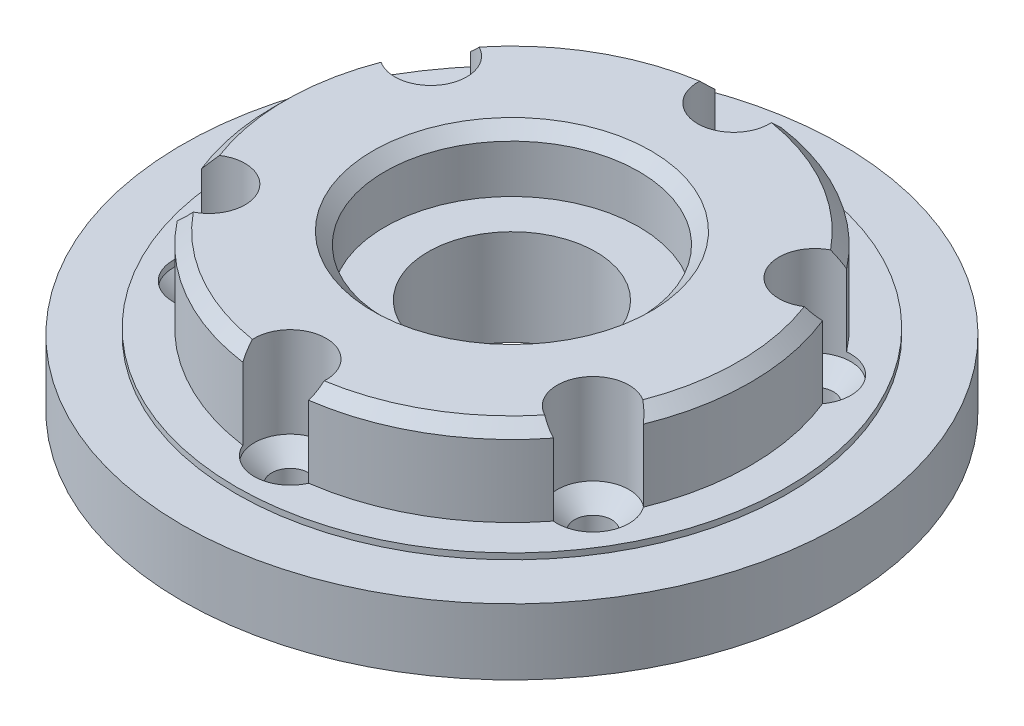
from build123d import *

# Parameters (mm, degrees)
FASE1_SIZE                                 = 1
F_3_1_3_1_DURCHMESSER_BOHRUNG1_D           = 3.1
F_3_1_3_1_DURCHMESSER_BOHRUNG1_DEPTH       = 15
F_3_1_3_1_DURCHMESSER_BOHRUNG1_CSINK_D     = 3.15
F_3_1_3_1_DURCHMESSER_BOHRUNG1_CSINK_ANGLE = 90
F_3_1_3_1_DURCHMESSER_BOHRUNG1_TIP         = 0.931333959
SCHNITT_LINEAR_AUSTRAGEN1_REACH            = 43.006
SKIZZE5_R                                  = 3
FASE2_SIZE                                 = 1.5


with BuildPart() as part:
    # Skizze1 → Rotation1 (revolve)
    with BuildSketch(Plane.XY, mode=Mode.PRIVATE) as rotation1_sk:
        Polygon((7, 0), (27.5, 0), (27.5, 5.5), (23, 5.5), (23, 6), (19.9, 6), (19.9, 13), (10.6, 13), (10.6, 8), (7, 8), align=None)
    revolve(rotation1_sk.sketch.rotate(Axis((0, 0, 0), (0, -1, 0)), 90), axis=Axis((0, 0, 0), (0, -1, 0)))

    # Fase1
    fase1_edges = [part.edges().sort_by_distance(p)[0] for p in [
        (0, 13, -19.9),
        (0, 13, -10.6),
    ]]
    chamfer(fase1_edges, length=FASE1_SIZE)

    # Ø3.1 (3.1) Durchmesser Bohrung1
    with Locations(Plane(origin=(0, 0, 0), x_dir=(-1, 0, 0), z_dir=(0, -1, 0))):
        with Locations((-16.02146997, 9.25), (0, 18.5), (16.02146997, 9.25), (16.02146997, -9.25), (0, -18.5), (-16.02146997, -9.25)):
            CounterSinkHole(F_3_1_3_1_DURCHMESSER_BOHRUNG1_D / 2, F_3_1_3_1_DURCHMESSER_BOHRUNG1_CSINK_D / 2, depth=F_3_1_3_1_DURCHMESSER_BOHRUNG1_DEPTH, counter_sink_angle=F_3_1_3_1_DURCHMESSER_BOHRUNG1_CSINK_ANGLE)
            with Locations((0, 0, -(F_3_1_3_1_DURCHMESSER_BOHRUNG1_DEPTH + F_3_1_3_1_DURCHMESSER_BOHRUNG1_TIP / 2))):  # 118° drill point
                Cone(0, F_3_1_3_1_DURCHMESSER_BOHRUNG1_D / 2, F_3_1_3_1_DURCHMESSER_BOHRUNG1_TIP, mode=Mode.SUBTRACT)

    # Schnitt-Linear austragen1: up to this face of the body (flat: up to its plane)
    schnitt_linear_austragen1_end = Plane(part.part.faces().sort_by_distance((0, 5.5, -26.722182541))[0])
    # Skizze5 → Schnitt-Linear austragen1 (cut, up to the picked face)
    with BuildSketch(Plane(origin=(0, 13, 0), x_dir=(1, 0, 0), z_dir=(0, 1, 0)), mode=Mode.PRIVATE) as schnitt_linear_austragen1_sk1:
        with Locations(Location((0, 18.5, 0), (0, 0, 3.077902124))):
            Circle(SKIZZE5_R)
    schnitt_linear_austragen1_tool1 = split(extrude(schnitt_linear_austragen1_sk1.sketch, amount=-SCHNITT_LINEAR_AUSTRAGEN1_REACH, mode=Mode.PRIVATE), bisect_by=schnitt_linear_austragen1_end, keep=Keep.BOTH, mode=Mode.PRIVATE)
    # Skizze5 → Schnitt-Linear austragen1 (cut, up to the picked face)
    with BuildSketch(Plane(origin=(0, 13, 0), x_dir=(1, 0, 0), z_dir=(0, 1, 0)), mode=Mode.PRIVATE) as schnitt_linear_austragen1_sk2:
        with Locations(Location((16.02146997, 9.25, 0), (0, 0, 303.077902124))):
            Circle(SKIZZE5_R)
    schnitt_linear_austragen1_tool2 = split(extrude(schnitt_linear_austragen1_sk2.sketch, amount=-SCHNITT_LINEAR_AUSTRAGEN1_REACH, mode=Mode.PRIVATE), bisect_by=schnitt_linear_austragen1_end, keep=Keep.BOTH, mode=Mode.PRIVATE)
    # Skizze5 → Schnitt-Linear austragen1 (cut, up to the picked face)
    with BuildSketch(Plane(origin=(0, 13, 0), x_dir=(1, 0, 0), z_dir=(0, 1, 0)), mode=Mode.PRIVATE) as schnitt_linear_austragen1_sk3:
        with Locations(Location((16.02146997, -9.25, 0), (0, 0, 263.781086479))):
            Circle(SKIZZE5_R)
    schnitt_linear_austragen1_tool3 = split(extrude(schnitt_linear_austragen1_sk3.sketch, amount=-SCHNITT_LINEAR_AUSTRAGEN1_REACH, mode=Mode.PRIVATE), bisect_by=schnitt_linear_austragen1_end, keep=Keep.BOTH, mode=Mode.PRIVATE)
    # Skizze5 → Schnitt-Linear austragen1 (cut, up to the picked face)
    with BuildSketch(Plane(origin=(0, 13, 0), x_dir=(1, 0, 0), z_dir=(0, 1, 0)), mode=Mode.PRIVATE) as schnitt_linear_austragen1_sk4:
        with Locations(Location((0, -18.5, 0), (0, 0, 336.2189135))):
            Circle(SKIZZE5_R)
    schnitt_linear_austragen1_tool4 = split(extrude(schnitt_linear_austragen1_sk4.sketch, amount=-SCHNITT_LINEAR_AUSTRAGEN1_REACH, mode=Mode.PRIVATE), bisect_by=schnitt_linear_austragen1_end, keep=Keep.BOTH, mode=Mode.PRIVATE)
    # Skizze5 → Schnitt-Linear austragen1 (cut, up to the picked face)
    with BuildSketch(Plane(origin=(0, 13, 0), x_dir=(1, 0, 0), z_dir=(0, 1, 0)), mode=Mode.PRIVATE) as schnitt_linear_austragen1_sk5:
        with Locations(Location((-16.02146997, -9.25, 0), (0, 0, 276.2189135))):
            Circle(SKIZZE5_R)
    schnitt_linear_austragen1_tool5 = split(extrude(schnitt_linear_austragen1_sk5.sketch, amount=-SCHNITT_LINEAR_AUSTRAGEN1_REACH, mode=Mode.PRIVATE), bisect_by=schnitt_linear_austragen1_end, keep=Keep.BOTH, mode=Mode.PRIVATE)
    # Skizze5 → Schnitt-Linear austragen1 (cut, up to the picked face)
    with BuildSketch(Plane(origin=(0, 13, 0), x_dir=(1, 0, 0), z_dir=(0, 1, 0)), mode=Mode.PRIVATE) as schnitt_linear_austragen1_sk6:
        with Locations(Location((-16.02146997, 9.25, 0), (0, 0, 236.922097816))):
            Circle(SKIZZE5_R)
    schnitt_linear_austragen1_tool6 = split(extrude(schnitt_linear_austragen1_sk6.sketch, amount=-SCHNITT_LINEAR_AUSTRAGEN1_REACH, mode=Mode.PRIVATE), bisect_by=schnitt_linear_austragen1_end, keep=Keep.BOTH, mode=Mode.PRIVATE)
    add(schnitt_linear_austragen1_tool1.solids().sort_by(Axis((0, 13, -18.5), (0, -1, 0)))[0], mode=Mode.SUBTRACT)
    add(schnitt_linear_austragen1_tool2.solids().sort_by(Axis((16.02147, 13, -9.25), (0, -1, 0)))[0], mode=Mode.SUBTRACT)
    add(schnitt_linear_austragen1_tool3.solids().sort_by(Axis((16.02147, 13, 9.25), (0, -1, 0)))[0], mode=Mode.SUBTRACT)
    add(schnitt_linear_austragen1_tool4.solids().sort_by(Axis((0, 13, 18.5), (0, -1, 0)))[0], mode=Mode.SUBTRACT)
    add(schnitt_linear_austragen1_tool5.solids().sort_by(Axis((-16.02147, 13, 9.25), (0, -1, 0)))[0], mode=Mode.SUBTRACT)
    add(schnitt_linear_austragen1_tool6.solids().sort_by(Axis((-16.02147, 13, -9.25), (0, -1, 0)))[0], mode=Mode.SUBTRACT)

    # Fase2
    # the kernel refuses this chamfer: 1.5 mm, written as the material it takes off along each edge
    with BuildSketch(Plane(origin=(0, 5.5, -18.5), x_dir=(1, 0, 0), z_dir=(0, 0, 1))) as fase2_piece_1_section:
        Polygon((1.55 + FASE2_SIZE, 0), (1.55, -FASE2_SIZE), (1.55, 0), align=None)
    fase2_piece_1 = revolve(axis=Axis((0, 5.5, -18.5), (0, 1, 0)), mode=Mode.PRIVATE)
    fase2_piece_1 = fase2_piece_1 & Plane(origin=(0, 4.721521587, -18.5), x_dir=(0.9985574532138488, 0, -0.053693692656328715), z_dir=(0, 1, 0)) * Cylinder(3, 13, mode=Mode.PRIVATE)
    add(fase2_piece_1, mode=Mode.SUBTRACT)
    with BuildSketch(Plane(origin=(16.02146997, 5.5, -9.25), x_dir=(1, 0, 0), z_dir=(0, 0, 1))) as fase2_piece_2_section:
        Polygon((1.55 + FASE2_SIZE, 0), (1.55, -FASE2_SIZE), (1.55, 0), align=None)
    fase2_piece_2 = revolve(axis=Axis((16.02146997, 5.5, -9.25), (0, 1, 0)), mode=Mode.PRIVATE)
    fase2_piece_2 = fase2_piece_2 & Plane(origin=(16.02146997, 4.721521587, -9.25), x_dir=(0.5457788284702986, 0, 0.83792927529332), z_dir=(0, 1, 0)) * Cylinder(3, 13, mode=Mode.PRIVATE)
    add(fase2_piece_2, mode=Mode.SUBTRACT)
    with BuildSketch(Plane(origin=(16.02146997, 5.5, 9.25), x_dir=(1, 0, 0), z_dir=(0, 0, 1))) as fase2_piece_3_section:
        Polygon((1.55 + FASE2_SIZE, 0), (1.55, -FASE2_SIZE), (1.55, 0), align=None)
    fase2_piece_3 = revolve(axis=Axis((16.02146997, 5.5, 9.25), (0, 1, 0)), mode=Mode.PRIVATE)
    fase2_piece_3 = fase2_piece_3 & Plane(origin=(16.02146997, 4.721521587, 9.25), x_dir=(-0.10832752224481851, 0, 0.9941152588730838), z_dir=(0, 1, 0)) * Cylinder(3, 13, mode=Mode.PRIVATE)
    add(fase2_piece_3, mode=Mode.SUBTRACT)
    with BuildSketch(Plane(origin=(0, 5.5, 18.5), x_dir=(1, 0, 0), z_dir=(0, 0, 1))) as fase2_piece_4_section:
        Polygon((1.55 + FASE2_SIZE, 0), (1.55, -FASE2_SIZE), (1.55, 0), align=None)
    fase2_piece_4 = revolve(axis=Axis((0, 5.5, 18.5), (0, 1, 0)), mode=Mode.PRIVATE)
    fase2_piece_4 = fase2_piece_4 & Plane(origin=(0, 4.721521587, 18.5), x_dir=(0.915092829448447, 0, 0.4032432435789042), z_dir=(0, 1, 0)) * Cylinder(3, 13, mode=Mode.PRIVATE)
    add(fase2_piece_4, mode=Mode.SUBTRACT)
    with BuildSketch(Plane(origin=(-16.02146997, 5.5, -9.25), x_dir=(1, 0, 0), z_dir=(0, 0, 1))) as fase2_piece_5_section:
        Polygon((1.55 + FASE2_SIZE, 0), (1.55, -FASE2_SIZE), (1.55, 0), align=None)
    fase2_piece_5 = revolve(axis=Axis((-16.02146997, 5.5, -9.25), (0, 1, 0)), mode=Mode.PRIVATE)
    fase2_piece_5 = fase2_piece_5 & Plane(origin=(-16.02146997, 4.721521587, -9.25), x_dir=(-0.5457788293477767, 0, 0.8379292747217814), z_dir=(0, 1, 0)) * Cylinder(3, 13, mode=Mode.PRIVATE)
    add(fase2_piece_5, mode=Mode.SUBTRACT)
    with BuildSketch(Plane(origin=(-16.02146997, 5.5, 9.25), x_dir=(1, 0, 0), z_dir=(0, 0, 1))) as fase2_piece_6_section:
        Polygon((1.55 + FASE2_SIZE, 0), (1.55, -FASE2_SIZE), (1.55, 0), align=None)
    fase2_piece_6 = revolve(axis=Axis((-16.02146997, 5.5, 9.25), (0, 1, 0)), mode=Mode.PRIVATE)
    fase2_piece_6 = fase2_piece_6 & Plane(origin=(-16.02146997, 4.721521587, 9.25), x_dir=(0.10832752188045662, 0, 0.9941152589127878), z_dir=(0, 1, 0)) * Cylinder(3, 13, mode=Mode.PRIVATE)
    add(fase2_piece_6, mode=Mode.SUBTRACT)


solid = part.part
